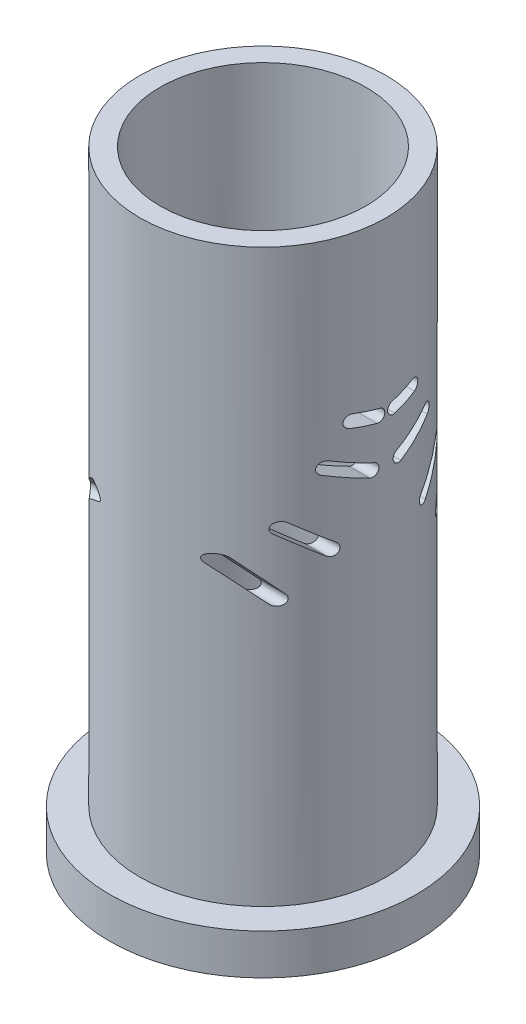
from build123d import *

# Parameters (mm, degrees)
SKETCH1_R           = 37.75
BOSS_EXTRUDE1_DEPTH = 10
SKETCH2_R           = 30.35
BOSS_EXTRUDE2_DEPTH = 140.65
SKETCH4_R           = 25.35
CUT_EXTRUDE1_DEPTH  = 308.65
CUT_EXTRUDE3_DEPTH  = 94


with BuildPart() as part:
    # Sketch1 → Boss-Extrude1 (new body)
    with BuildSketch(Plane(origin=(0, 0, 0), x_dir=(1, 0, 0), z_dir=(0, 1, 0))):
        Circle(SKETCH1_R)
    extrude(amount=BOSS_EXTRUDE1_DEPTH)

    # Sketch2 → Boss-Extrude2 (add)
    with BuildSketch(Plane(origin=(0, 10, 0), x_dir=(1, 0, 0), z_dir=(0, 1, 0))):
        Circle(SKETCH2_R)
    extrude(amount=BOSS_EXTRUDE2_DEPTH)

    # Sketch4 → Cut-Extrude1 (cut)
    with BuildSketch(Plane(origin=(0, 150.65, 0), x_dir=(1, 0, 0), z_dir=(0, 1, 0))):
        Circle(SKETCH4_R)
    extrude(amount=-CUT_EXTRUDE1_DEPTH, mode=Mode.SUBTRACT)

    # Sketch5 → Cut-Extrude3 (cut)
    with BuildSketch(Plane.ZY.offset(30.35)):
        with BuildLine():
            Line((-18.507755964, 76.49513311), (-25.102385952, 84.012503349))
            ThreePointArc((-25.102385952, 84.012503349), (-27.219185986, 84.150914387), (-27.357597024, 82.034114353))
            Line((-27.357597024, 82.034114353), (-20.762967035, 74.516744114))
            ThreePointArc((-20.762967035, 74.516744114), (-18.646167001, 74.378333076), (-18.507755964, 76.49513311))
        make_face()
        with BuildLine():
            Line((-8.036213189, 109.12979548), (-2.177779507, 107.834127774))
            ThreePointArc((-2.177779507, 107.834127774), (-0.389254161, 108.974819267), (-1.529945654, 110.763344614))
            Line((-1.529945654, 110.763344614), (-7.388379336, 112.05901232))
            ThreePointArc((-7.388379336, 112.05901232), (-9.176904682, 110.918320826), (-8.036213189, 109.12979548))
        make_face()
        with BuildLine():
            Line((-10.35172301, 85.644741564), (-18.290871874, 91.725030645))
            ThreePointArc((-18.290871874, 91.725030645), (-20.393787566, 91.446201678), (-20.114958598, 89.343285986))
            Line((-20.114958598, 89.343285986), (-12.175809734, 83.262996904))
            ThreePointArc((-12.175809734, 83.262996904), (-10.072894042, 83.541825872), (-10.35172301, 85.644741564))
        make_face()
        with BuildLine():
            Line((-13.05654699, 100.765674021), (-3.830667446, 96.907805874))
            ThreePointArc((-3.830667446, 96.907805874), (-1.868105293, 97.713007584), (-2.673307002, 99.675569737))
            Line((-2.673307002, 99.675569737), (-11.899186546, 103.533437884))
            ThreePointArc((-11.899186546, 103.533437884), (-13.8617487, 102.728236175), (-13.05654699, 100.765674021))
        make_face()
        with BuildLine():
            Line((12.175809734, 83.262996904), (20.114958598, 89.343285986))
            ThreePointArc((20.114958598, 89.343285986), (20.393787566, 91.446201678), (18.290871874, 91.725030645))
            Line((18.290871874, 91.725030645), (10.35172301, 85.644741564))
            ThreePointArc((10.35172301, 85.644741564), (10.072894042, 83.541825872), (12.175809734, 83.262996904))
        make_face()
        with BuildLine():
            Line((25.102385952, 84.012503349), (18.507755964, 76.49513311))
            ThreePointArc((18.507755964, 76.49513311), (18.646167001, 74.378333076), (20.762967035, 74.516744114))
            Line((20.762967035, 74.516744114), (27.357597024, 82.034114353))
            ThreePointArc((27.357597024, 82.034114353), (27.219185986, 84.150914387), (25.102385952, 84.012503349))
        make_face()
        with BuildLine():
            Line((3.830667446, 96.907805874), (13.05654699, 100.765674021))
            ThreePointArc((13.05654699, 100.765674021), (13.8617487, 102.728236175), (11.899186546, 103.533437884))
            Line((11.899186546, 103.533437884), (2.673307002, 99.675569737))
            ThreePointArc((2.673307002, 99.675569737), (1.868105293, 97.713007584), (3.830667446, 96.907805874))
        make_face()
        with BuildLine():
            Line((7.388379336, 112.05901232), (1.529945654, 110.763344614))
            ThreePointArc((1.529945654, 110.763344614), (0.389254161, 108.974819267), (2.177779507, 107.834127774))
            Line((2.177779507, 107.834127774), (8.036213189, 109.12979548))
            ThreePointArc((8.036213189, 109.12979548), (9.176904682, 110.918320826), (7.388379336, 112.05901232))
        make_face()
    extrude(amount=-CUT_EXTRUDE3_DEPTH, mode=Mode.SUBTRACT)


solid = part.part
